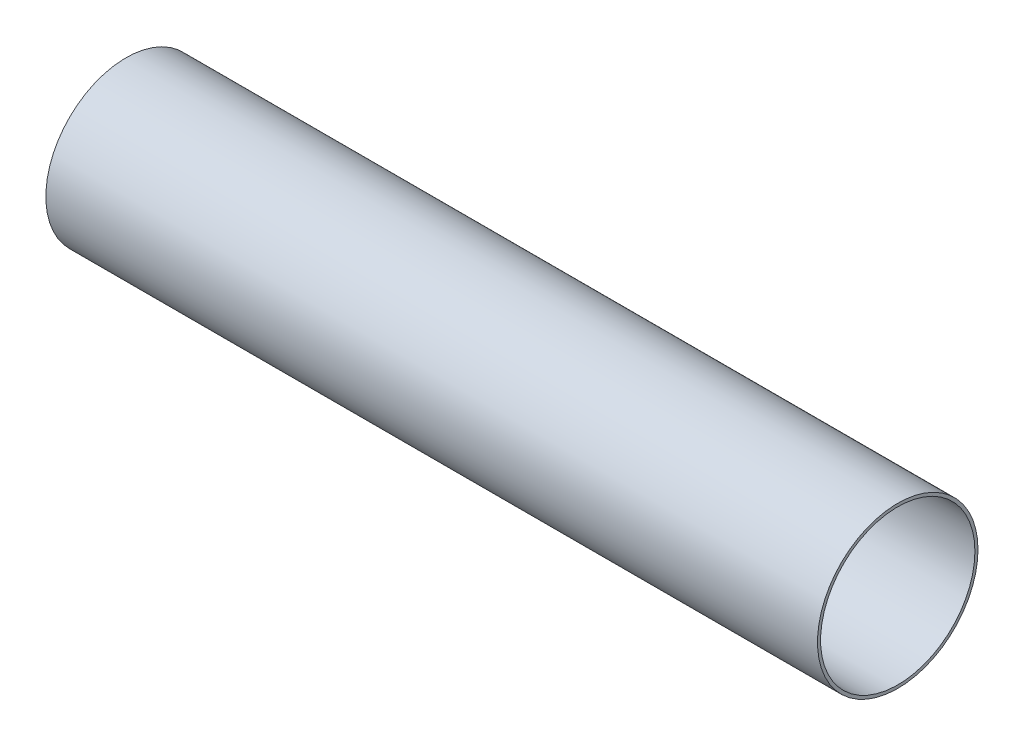
from build123d import *

# Parameters (mm, degrees)
SKETCH1_R           = 39.624
SKETCH1_R_2         = 38.1
BOSS_EXTRUDE1_DEPTH = 381


with BuildPart() as part:
    # Sketch1 → Boss-Extrude1 (new body)
    with BuildSketch(Plane.YZ):
        Circle(SKETCH1_R)
        Circle(SKETCH1_R_2, mode=Mode.SUBTRACT)
    extrude(amount=BOSS_EXTRUDE1_DEPTH)


solid = part.part
